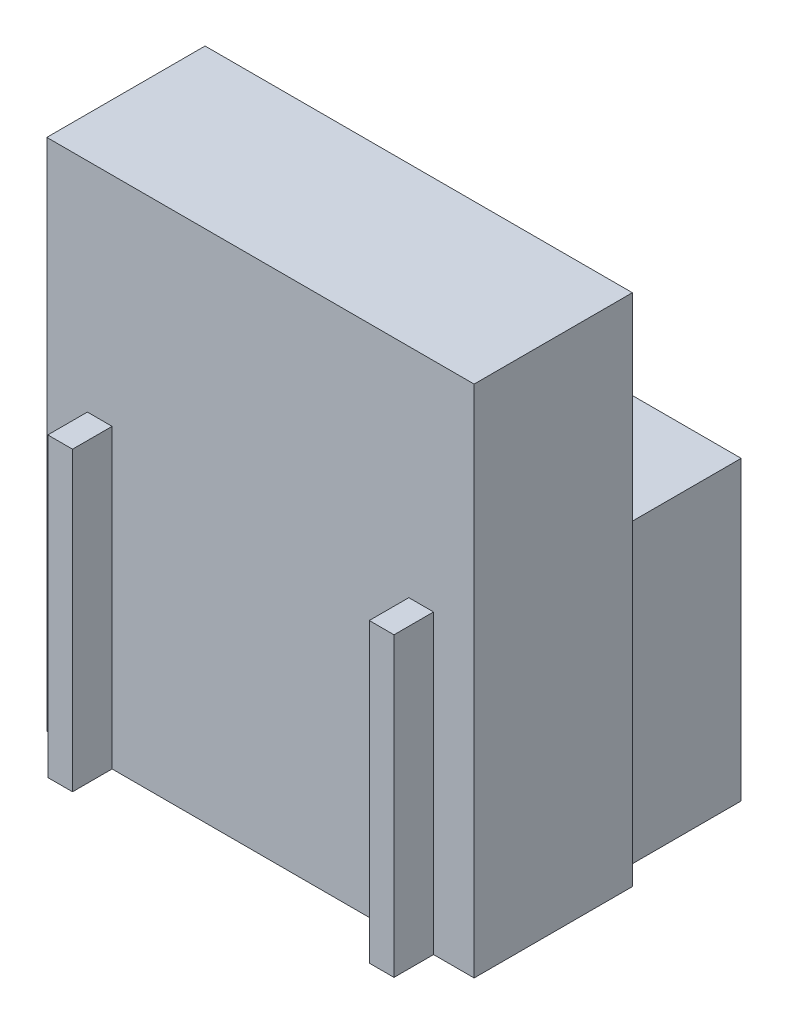
from build123d import *

# Parameters (mm, degrees)
SKETCH_1_W      = 43.2
SKETCH_1_H      = 52
EXTRUDE_3_DEPTH = 16
SKETCH_2_W      = 2.5
SKETCH_2_H      = 30
EXTRUDE_4_DEPTH = 4
SKETCH_3_W      = 39.2
SKETCH_3_H      = 30
EXTRUDE_5_DEPTH = 13


with BuildPart() as part:
    # 草图1 → 凸台-拉伸3 (new body)
    with BuildSketch(Plane.XY):
        Rectangle(SKETCH_1_W, SKETCH_1_H)
    extrude(amount=EXTRUDE_3_DEPTH)

    # 草图2 → 凸台-拉伸4 (add)
    with BuildSketch(Plane.XY.offset(16)):
        with Locations((-16.25, -11)):
            Rectangle(SKETCH_2_W, SKETCH_2_H)
        with Locations((16.25, -11)):
            Rectangle(SKETCH_2_W, SKETCH_2_H)
    extrude(amount=EXTRUDE_4_DEPTH)

    # 草图3 → 凸台-拉伸5 (add)
    with BuildSketch(Plane(origin=(0, 0, 0), x_dir=(-1, 0, 0), z_dir=(0, 0, -1))):
        with Locations((0, -11)):
            Rectangle(SKETCH_3_W, SKETCH_3_H)
    extrude(amount=EXTRUDE_5_DEPTH)


solid = part.part
